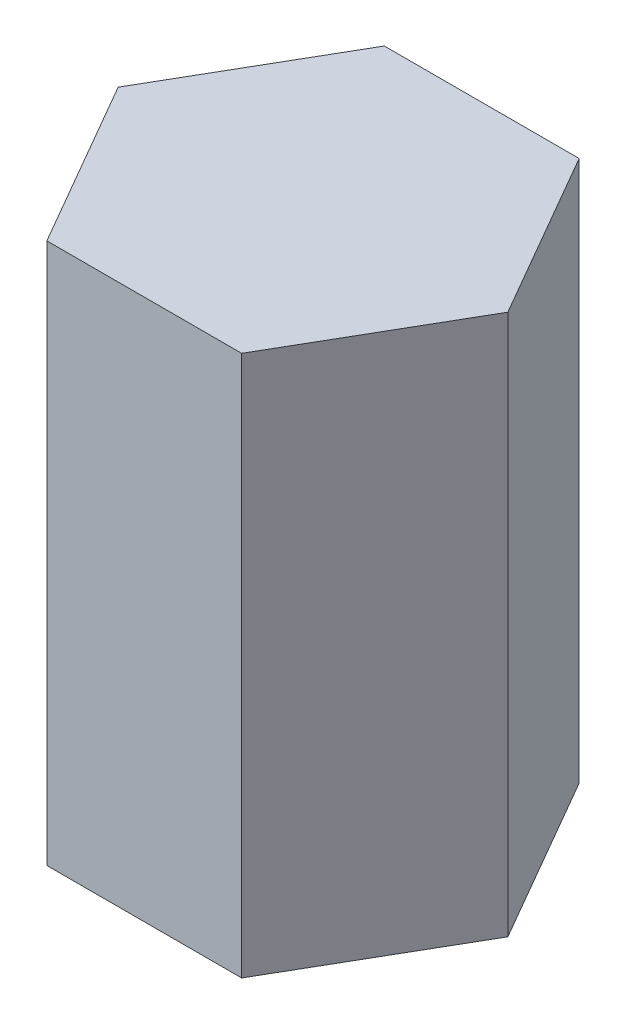
from build123d import *

# Parameters (mm, degrees)
BOSS_EXTRUDE1_DEPTH = 1603
CUT_EXTRUDE1_DEPTH  = 1187.25


with BuildPart() as part:
    # Sketch2 → Boss-Extrude1 (new body)
    with BuildSketch(Plane(origin=(0, 0, 0), x_dir=(1, 0, 0), z_dir=(0, 1, 0))):
        Polygon((577.35026919, 0), (288.675134595, 500), (-288.675134595, 500), (-577.35026919, 0), (-288.675134595, -500), (288.675134595, -500), align=None)
    extrude(amount=BOSS_EXTRUDE1_DEPTH)

    # Sketch3 → Cut-Extrude1 (cut)
    with BuildSketch(Plane(origin=(0, 400.75, 0), x_dir=(1, 0, 0), z_dir=(0, 1, 0))):
        Polygon((560.029761114, 0), (280.014880557, 485), (-280.014880557, 485), (-560.029761114, 0), (-280.014880557, -485), (280.014880557, -485), align=None)
    extrude(amount=CUT_EXTRUDE1_DEPTH, mode=Mode.SUBTRACT)


solid = part.part
